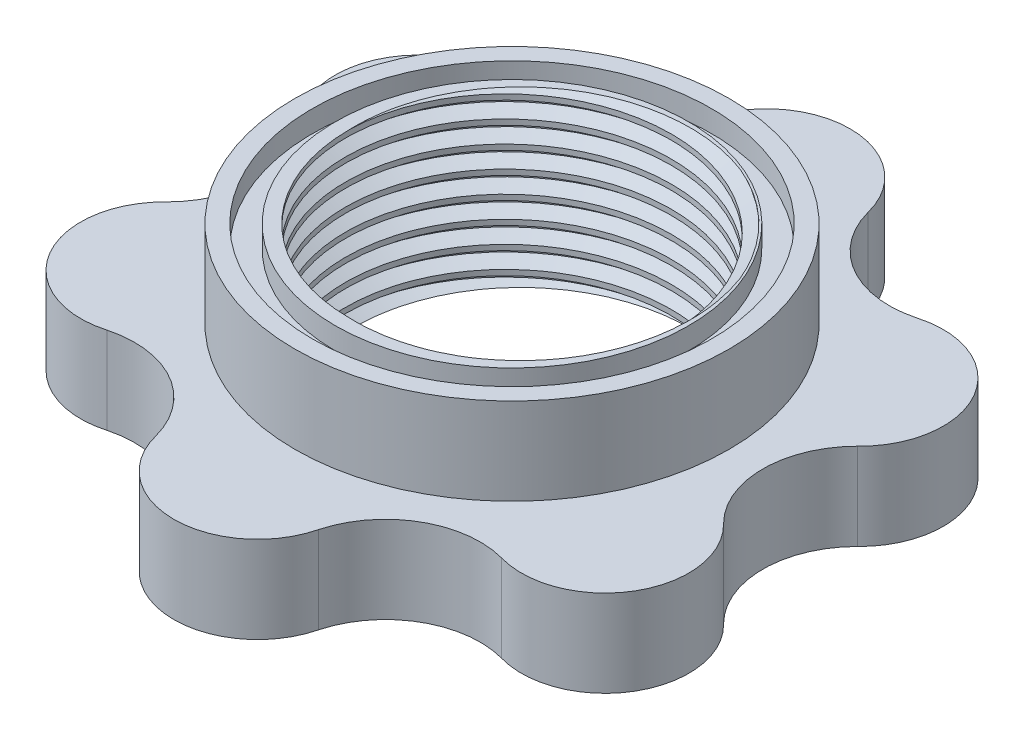
from build123d import *

# Parameters (mm, degrees)
CROQUIS2_R              = 15
SALIENTE_EXTRUIR2_DEPTH = 8
CROQUIS3_R              = 16.274172988
CROQUIS3_R_2            = 15
SALIENTE_EXTRUIR3_DEPTH = 8
CROQUIS7_R              = 20
CROQUIS7_R_2            = 16.274172988
SALIENTE_EXTRUIR8_DEPTH = 8
CORTAR_EXTRUIR4_START   = -2
CROQUIS9_R              = 18.383863482
CROQUIS9_R_2            = 16.274172988
CORTAR_EXTRUIR4_DEPTH   = 2
ROSCA2_PITCH            = 2


with BuildPart() as part:
    # Croquis2 → Saliente-Extruir2 (new body)
    with BuildSketch(Plane(origin=(0, 0, 0), x_dir=(1, 0, 0), z_dir=(0, 1, 0))):
        with BuildLine():
            ThreePointArc((18.178264702, 19.134690273), (11.553481504, 20.006859528), (7.485769174, 25.308005445))
            ThreePointArc((7.485769174, 25.308005445), (0.001789675, 31.150738213), (-7.482189824, 25.308005445))
            ThreePointArc((-7.482189824, 25.308005445), (-11.549902153, 20.006859528), (-18.174685352, 19.134690273))
            ThreePointArc((-18.174685352, 19.134690273), (-26.976630106, 15.57474029), (-25.658664851, 6.172057539))
            ThreePointArc((-25.658664851, 6.172057539), (-23.101593982, -0.001257633), (-25.658664851, -6.174572805))
            ThreePointArc((-25.658664851, -6.174572805), (-26.976630106, -15.577255556), (-18.174685352, -19.137205539))
            ThreePointArc((-18.174685352, -19.137205539), (-11.549902153, -20.009374793), (-7.482189824, -25.310520711))
            ThreePointArc((-7.482189824, -25.310520711), (0.001789675, -31.153253479), (7.485769174, -25.310520711))
            ThreePointArc((7.485769174, -25.310520711), (11.553481504, -20.009374793), (18.178264702, -19.137205539))
            ThreePointArc((18.178264702, -19.137205539), (26.980209456, -15.577255556), (25.662244201, -6.174572805))
            ThreePointArc((25.662244201, -6.174572805), (23.105173332, -0.001257633), (25.662244201, 6.172057539))
            ThreePointArc((25.662244201, 6.172057539), (26.980209456, 15.57474029), (18.178264702, 19.134690273))
        make_face()
        with Locations(Location((0.001789675, -0.001257633, 0), (0, 0, 270))):
            Circle(CROQUIS2_R, mode=Mode.SUBTRACT)
    extrude(amount=SALIENTE_EXTRUIR2_DEPTH)

    # Croquis3 → Saliente-Extruir3 (add)
    with BuildSketch(Plane(origin=(0, 8, 0), x_dir=(1, 0, 0), z_dir=(0, 1, 0))):
        with Locations(Location((0, 0, 0), (0, 0, 270))):
            Circle(CROQUIS3_R)
        with Locations(Location((0.001789675, -0.001257633, 0), (0, 0, 270))):
            Circle(CROQUIS3_R_2, mode=Mode.SUBTRACT)
    extrude(amount=SALIENTE_EXTRUIR3_DEPTH)

    # Rosca2: the profile of Perfil de rosca2 profile screwed along a right-hand helix of 20 turns, 10 arcs to a turn; built about Z, then put on its axis
    rosca2_z = Axis((0, 0, 0), (0, 0, 1))
    rosca2_corners = [(14.9997, 0, -0.000173205), (16.08253175, 0, 0.624999997), (16.08253175, 0, 0.874999997), (14.9997, 0, 1.5001732)]
    with BuildLine(mode=Mode.PRIVATE) as rosca2_profile:
        Line(rosca2_corners[0], rosca2_corners[1])
        Line(rosca2_corners[1], rosca2_corners[2])
        Line(rosca2_corners[2], rosca2_corners[3])
        Line(rosca2_corners[3], rosca2_corners[0])
    rosca2_cap = Face(rosca2_profile.wire())
    rosca2_turn_angles = [0, 18, 36, 54, 72, 90, 108, 126, 144, 162, 180, 198, 216, 234, 252, 270, 288, 306, 324, 342, 360]
    rosca2_turn_weights = [1, 0.9510565162951535, 1, 0.9510565162951535, 1, 0.9510565162951535, 1, 0.9510565162951535, 1, 0.9510565162951535, 1, 0.9510565162951535, 1, 0.9510565162951535, 1, 0.9510565162951535, 1, 0.9510565162951535, 1, 0.9510565162951535, 1]
    rosca2_turn_rails = [Edge.make_bspline([Vector(p[0], p[1], 0).rotate(rosca2_z, rosca2_turn_angles[k]) / rosca2_turn_weights[k] + Vector(0, 0, p[2] + ROSCA2_PITCH * rosca2_turn_angles[k] / 360) for k in range(21)], [0, 0, 0, 1, 1, 2, 2, 3, 3, 4, 4, 5, 5, 6, 6, 7, 7, 8, 8, 9, 9, 10, 10, 10], 2, rosca2_turn_weights) for p in rosca2_corners]
    rosca2_turn_sides = [Face.make_surface_from_curves(rosca2_turn_rails[p[0]], rosca2_turn_rails[p[1]]) for p in [(0, 1), (1, 2), (2, 3), (3, 0)]]
    rosca2 = Plane(origin=(0.001789675, -1, 0.001257633), x_dir=(1, 0, 0), z_dir=(0, 1, 0)) * Solid(Shell([*[p.moved(Location((0, 0, ROSCA2_PITCH * i))) for i in range(20) for p in rosca2_turn_sides], rosca2_cap, rosca2_cap.rotate(rosca2_z, 7200).moved(Location((0, 0, ROSCA2_PITCH * 7200 / 360)))]))
    add(rosca2, mode=Mode.SUBTRACT)


with BuildPart() as body_2:
    # Croquis7 → Saliente-Extruir8 (new body)
    with BuildSketch(Plane(origin=(0, 8, 0), x_dir=(1, 0, 0), z_dir=(0, 1, 0))):
        with Locations(Location((0, 0, 0), (0, 0, 270))):
            Circle(CROQUIS7_R)
        with Locations(Location((0, 0, 0), (0, 0, 270))):
            Circle(CROQUIS7_R_2, mode=Mode.SUBTRACT)
    extrude(amount=SALIENTE_EXTRUIR8_DEPTH)

    # Croquis9 → Cortar-Extruir4 (cut)
    with BuildSketch(Plane(origin=(0, 16, 0), x_dir=(1, 0, 0), z_dir=(0, 1, 0)).offset(CORTAR_EXTRUIR4_START)):
        with Locations(Location((0, 0, 0), (0, 0, 270))):
            Circle(CROQUIS9_R)
        with Locations(Location((0, 0, 0), (0, 0, 270))):
            Circle(CROQUIS9_R_2, mode=Mode.SUBTRACT)
    extrude(amount=CORTAR_EXTRUIR4_DEPTH, mode=Mode.SUBTRACT)


solid = Compound([part.part, body_2.part])
